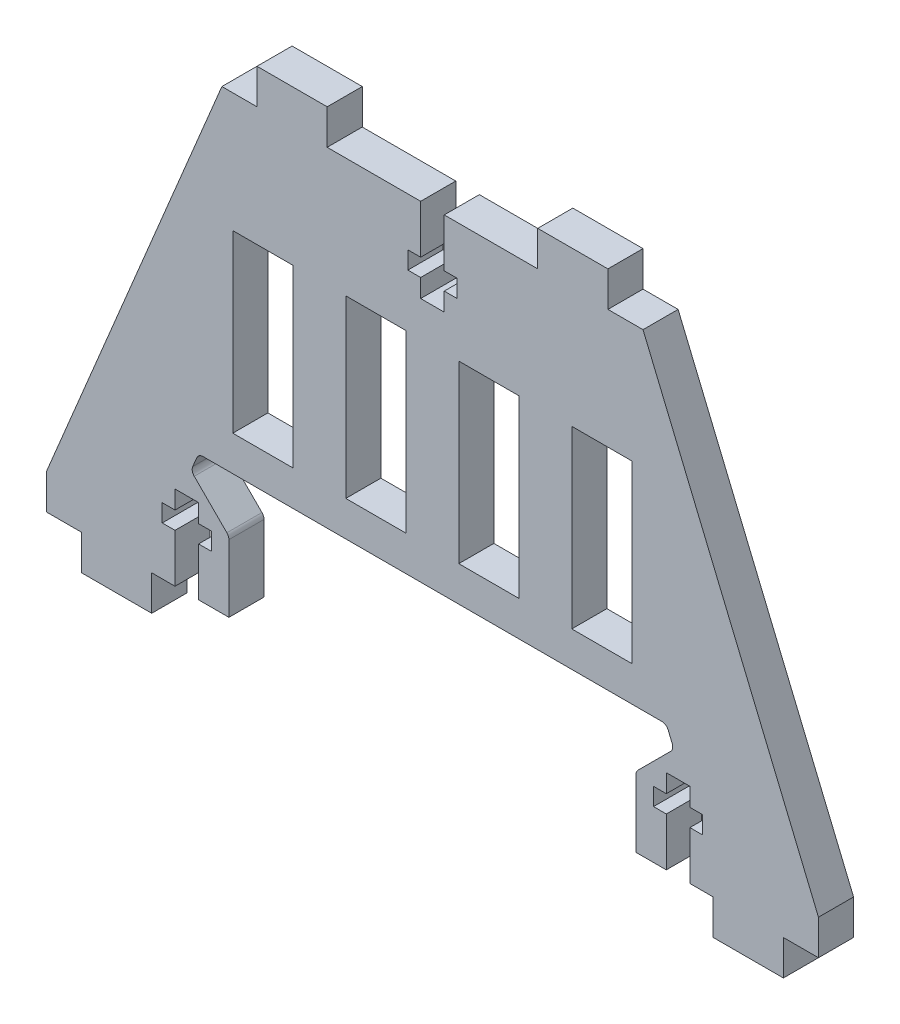
from build123d import *

# Parameters (mm, degrees)
SKETCH1_W               = 139.7
SKETCH1_H               = 82.55
BOSS_EXTRUDE1_DEPTH     = 6.35
SKETCH2_W               = 12.7
SKETCH2_H               = 6.35
BOSS_EXTRUDE2_DEPTH     = 6.35
CUT_EXTRUDE1_DEPTH      = 6.35
CUT_EXTRUDE8_DEPTH      = 6.35
CUT_EXTRUDE2_DEPTH      = 6.35
CUT_EXTRUDE9_DEPTH      = 85.77904001
CUT_EXTRUDE9_DEPTH_BACK = 85.77904001
FILLET1_R               = 1.27
SKETCH9_W               = 10.922
SKETCH9_H               = 31.75
SWITCHES_CUT_DEPTH      = 85.77904001


with BuildPart() as part:
    # Sketch1 → Boss-Extrude1 (new body)
    with BuildSketch(Plane.XY):
        Rectangle(SKETCH1_W, SKETCH1_H)
    extrude(amount=BOSS_EXTRUDE1_DEPTH)

    # Sketch2 → Boss-Extrude2 (add)
    with BuildSketch(Plane(origin=(0, 0, 0), x_dir=(-1, 0, 0), z_dir=(0, 0, -1))):
        with Locations((-57.15, -44.45)):
            Rectangle(SKETCH2_W, SKETCH2_H)
        with Locations((-25.4, 44.45)):
            Rectangle(SKETCH2_W, SKETCH2_H)
    boss_extrude2 = extrude(amount=-BOSS_EXTRUDE2_DEPTH)

    # Sketch3 → Cut-Extrude1 (cut)
    with BuildSketch(Plane(origin=(0, 0, 0), x_dir=(-1, 0, 0), z_dir=(0, 0, -1))):
        Polygon((-46.5836, -41.275), (-46.5836, -32.512), (-48.895, -32.512), (-48.895, -29.337), (-46.5836, -29.337), (-46.5836, -26.035), (-42.3164, -26.035), (-42.3164, -29.337), (-40.005, -29.337), (-40.005, -32.512), (-42.3164, -32.512), (-42.3164, -41.275), align=None)
    cut_extrude1 = extrude(amount=-CUT_EXTRUDE1_DEPTH, mode=Mode.SUBTRACT)

    # Sketch7 → Cut-Extrude8 (cut)
    with BuildSketch(Plane(origin=(0, 0, 0), x_dir=(-1, 0, 0), z_dir=(0, 0, -1))):
        Polygon((-38.1, 41.275), (-69.85, -34.925), (-69.85, 41.275), align=None)
    cut_extrude8 = extrude(amount=-CUT_EXTRUDE8_DEPTH, mode=Mode.SUBTRACT)

    # Mirror2: Boss-Extrude2, Cut-Extrude8 across plane
    add(boss_extrude2.mirror(Plane(origin=(0, 0, 0), x_dir=(0, 0, 1), z_dir=(1, 0, 0))))
    add(cut_extrude8.mirror(Plane(origin=(0, 0, 0), x_dir=(0, 0, 1), z_dir=(1, 0, 0))), mode=Mode.SUBTRACT)

    # Mirror4: Cut-Extrude1 across plane
    add(cut_extrude1.mirror(Plane(origin=(0, 0, 0), x_dir=(0, 0, 1), z_dir=(1, 0, 0))), mode=Mode.SUBTRACT)

    # Sketch4 → Cut-Extrude2 (cut)
    with BuildSketch(Plane(origin=(0, 0, 0), x_dir=(-1, 0, 0), z_dir=(0, 0, -1))):
        Polygon((2.1336, 41.275), (-2.1336, 41.275), (-2.1336, 32.512), (-4.445, 32.512), (-4.445, 29.337), (-2.1336, 29.337), (-2.1336, 26.035), (2.1336, 26.035), (2.1336, 29.337), (4.445, 29.337), (4.445, 32.512), (2.1336, 32.512), align=None)
    extrude(amount=-CUT_EXTRUDE2_DEPTH, mode=Mode.SUBTRACT)

    # Sketch8 → Cut-Extrude9 (cut, two sides: drawn at the far end of the back side and taken through both)
    with BuildSketch(Plane.XY.offset(6.35).offset(-CUT_EXTRUDE9_DEPTH_BACK)):
        Polygon((-36.83, -28.575), (-43.702941176, -21.702058824), (-42.333333333, -18.415), (42.333333333, -18.415), (43.702941176, -21.702058824), (36.83, -28.575), (36.83, -41.275), (-36.83, -41.275), align=None)
    extrude(amount=CUT_EXTRUDE9_DEPTH + CUT_EXTRUDE9_DEPTH_BACK, mode=Mode.SUBTRACT)

    # Fillet1
    fillet1_edges = [part.edges().sort_by_distance(p)[0] for p in [
        (36.83, -28.575, 3.175),
        (43.702941176, -21.702058824, 3.175),
        (42.333333333, -18.415, 3.175),
        (-42.333333333, -18.415, 3.175),
        (-43.702941176, -21.702058824, 3.175),
        (-36.83, -28.575, 3.175),
    ]]
    fillet(fillet1_edges, radius=FILLET1_R)

    # Sketch9 → Switches Cut (cut, through all)
    with BuildSketch(Plane.XY.offset(6.35)):
        with Locations((-30.6705, 3.81)):
            Rectangle(SKETCH9_W, SKETCH9_H)
        with Locations((-10.2235, 3.81)):
            Rectangle(SKETCH9_W, SKETCH9_H)
        with Locations((10.2235, 3.81)):
            Rectangle(SKETCH9_W, SKETCH9_H)
        with Locations((30.6705, 3.81)):
            Rectangle(SKETCH9_W, SKETCH9_H)
    extrude(amount=-SWITCHES_CUT_DEPTH, mode=Mode.SUBTRACT)


solid = part.part
